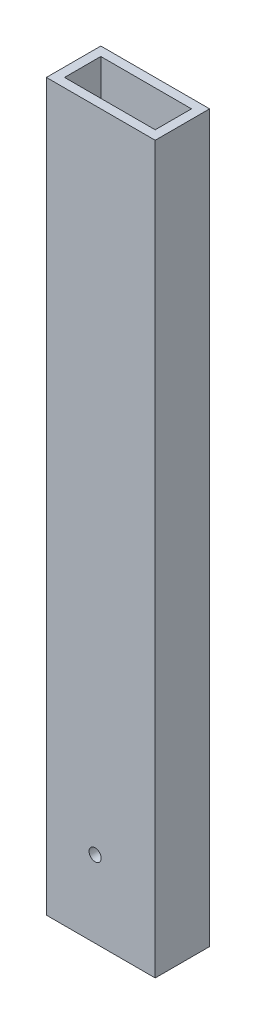
from build123d import *

# Parameters (mm, degrees)
SKETCH1_W           = 38.1
SKETCH1_H           = 19.05
SKETCH1_W_2         = 31.75
SKETCH1_H_2         = 12.7
BOSS_EXTRUDE1_DEPTH = 254
SKETCH2_R           = 2.125
CUT_EXTRUDE1_DEPTH  = 258.547107342


with BuildPart() as part:
    # Sketch1 → Boss-Extrude1 (new body)
    with BuildSketch(Plane(origin=(0, 0, 0), x_dir=(1, 0, 0), z_dir=(0, 1, 0))):
        with Locations((19.05, 9.525)):
            Rectangle(SKETCH1_W, SKETCH1_H)
        with Locations((19.05, 9.525)):
            Rectangle(SKETCH1_W_2, SKETCH1_H_2, mode=Mode.SUBTRACT)
    extrude(amount=BOSS_EXTRUDE1_DEPTH)

    # Sketch2 → Cut-Extrude1 (cut, through all)
    with BuildSketch(Plane(origin=(0, 0, -19.05), x_dir=(-1, 0, 0), z_dir=(0, 0, -1))):
        with Locations((-17.062243871, 26.832679639)):
            Circle(SKETCH2_R)
    extrude(amount=-CUT_EXTRUDE1_DEPTH, mode=Mode.SUBTRACT)


solid = part.part
